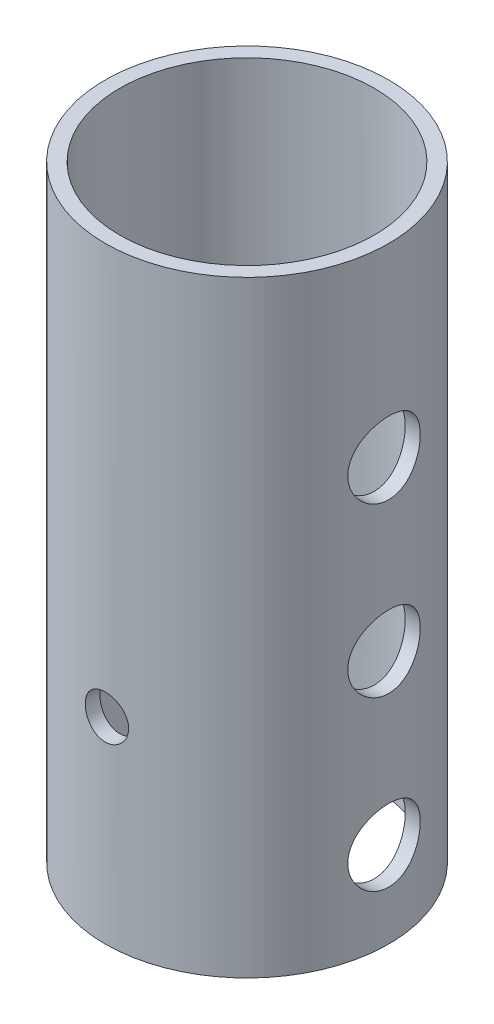
from build123d import *

# Parameters (mm, degrees)
SKETCH1_R           = 49
SKETCH1_R_2         = 44
BOSS_EXTRUDE1_DEPTH = 209.8
SKETCH2_R           = 12.53
CUT_EXTRUDE1_DEPTH  = 221.948048192
SKETCH4_R           = 7.5
CUT_EXTRUDE2_DEPTH  = 221.948048332
SKETCH5_R           = 7.5
CUT_EXTRUDE3_DEPTH  = 221.948048332


with BuildPart() as part:
    # Sketch1 → Boss-Extrude1 (new body)
    with BuildSketch(Plane(origin=(0, 0, 0), x_dir=(1, 0, 0), z_dir=(0, 1, 0))):
        Circle(SKETCH1_R)
        Circle(SKETCH1_R_2, mode=Mode.SUBTRACT)
    extrude(amount=BOSS_EXTRUDE1_DEPTH)

    # Sketch2 → Cut-Extrude1 (cut, through all)
    with BuildSketch(Plane(origin=(0, 0, 0), x_dir=(0, 0, -1), z_dir=(1, 0, 0))):
        with Locations((0, 145.6)):
            Circle(SKETCH2_R)
        with Locations((0, 87.6)):
            Circle(SKETCH2_R)
        with Locations((0, 29.6)):
            Circle(SKETCH2_R)
    extrude(amount=CUT_EXTRUDE1_DEPTH, mode=Mode.SUBTRACT)

    # Sketch4 → Cut-Extrude2 (cut, through all)
    with BuildSketch(Plane.XY):
        with Locations((0, 68)):
            Circle(SKETCH4_R)
    extrude(amount=CUT_EXTRUDE2_DEPTH, mode=Mode.SUBTRACT)

    # Sketch5 → Cut-Extrude3 (cut, through all)
    with BuildSketch(Plane.XY):
        with Locations((0, 141.8)):
            Circle(SKETCH5_R)
    extrude(amount=-CUT_EXTRUDE3_DEPTH, mode=Mode.SUBTRACT)


solid = part.part
